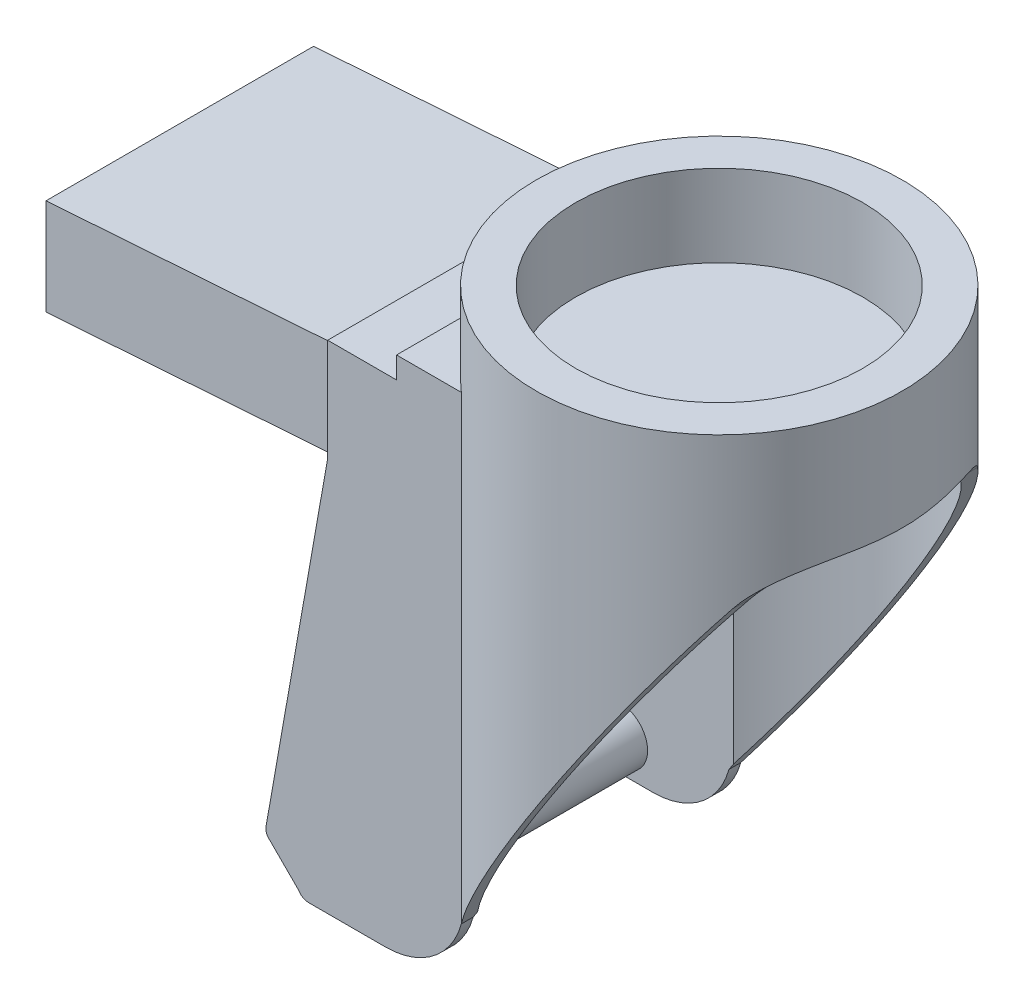
from build123d import *

# Parameters (mm, degrees)
ESTRUSIONE_ESTRUSIONE1_DEPTH         = 71
ESTRUSIONE_ESTRUSIONE5_START         = -131.7
SCHIZZO8_R                           = 46.5
ESTRUSIONE_ESTRUSIONE5_DEPTH         = 131.7
TAGLIO_ESTRUSIONE1_REACH             = 183.054
TAGLIO_ESTRUSIONE1_DIRECTION_2_REACH = 183.054
RACCORDO1_R                          = 20
TAGLIO_ESTRUSIONE2_REACH             = 188.942
SVUOTA1_START                        = -8.5
SVUOTA1_DEPTH                        = 123.2
SVUOTA1_START_2                      = 114.7
SVUOTA1_2_DEPTH                      = 5.5
ESTRUSIONE_ESTRUSIONE7_START         = 1.5
ESTRUSIONE_ESTRUSIONE7_DEPTH         = 68
ESTRUSIONE_ESTRUSIONE7_2_DEPTH       = 3
ESTRUSIONE_ESTRUSIONE7_START_2       = 66.5
ESTRUSIONE_ESTRUSIONE7_3_DEPTH       = 3
SCHIZZO15_R                          = 46.5
SCHIZZO15_R_2                        = 36.5
ESTRUSIONE_ESTRUSIONE8_DEPTH         = 20.79
ESTRUSIONE_ESTRUSIONE9_REACH         = 196.557
SCHIZZO16_R                          = 7.1


# Read off the part's stored shape, not the designer's step: Svuota1, Estrusione-Estrusione7
with BuildPart() as part:
    # Schizzo1 → Estrusione-Estrusione1 (new body)
    with BuildSketch(Plane.XY):
        with BuildLine():
            Line((11.3, 123.2), (104.3, 123.2))
            Line((104.3, 123.2), (104.3, 113.85))
            Line((104.3, 113.85), (24.875337306, -8.5))
            Line((24.875337306, -8.5), (-11.01, -8.5))
            ThreePointArc((-11.01, -8.5), (-12.511694022, -8.09709743), (-13.610030458, -6.996610042))
            Line((-13.610030458, -6.996610042), (-21.501342136, 0.894701636))
            ThreePointArc((-21.501342136, 0.894701636), (-21.856035983, 1.872259448), (-21.855688892, 2.912176215))
            Line((-21.855688892, 2.912176215), (-6.2, 91.7))
            Line((-6.2, 91.7), (-6.2, 117.7))
            Line((-6.2, 117.7), (11.3, 117.7))
            Line((11.3, 117.7), (11.3, 123.2))
        make_face()
    extrude(amount=ESTRUSIONE_ESTRUSIONE1_DEPTH)

    # Schizzo8 → Estrusione-Estrusione5 (add)
    with BuildSketch(Plane(origin=(0, 123.2, 0), x_dir=(1, 0, 0), z_dir=(0, 1, 0)).offset(ESTRUSIONE_ESTRUSIONE5_START)):
        with Locations((57.8, -35.5)):
            Circle(SCHIZZO8_R)
    extrude(amount=ESTRUSIONE_ESTRUSIONE5_DEPTH)

    # Schizzo9 → Taglio-Estrusione1 (cut, up to next)
    with BuildSketch(Plane.XY, mode=Mode.PRIVATE) as taglio_estrusione1_sk1:
        with BuildLine():
            Line((27.766685165, 6.220424861), (92.30584512, 105.64))
            add(Edge.make_bspline(
                [(92.30584512, 105.64), (97.635444472, 113.85), (104.3, 113.85)],
                knots=[0, 0, 0, 1, 1, 1], degree=2, weights=[1, 0.701406821, 1]))
            Line((104.3, 113.85), (104.3, -8.5))
            Line((104.3, -8.5), (27.766685165, -8.5))
            Line((27.766685165, -8.5), (27.766685165, 6.220424861))
        make_face()
    taglio_estrusione1_tool1 = extrude(taglio_estrusione1_sk1.sketch, amount=TAGLIO_ESTRUSIONE1_REACH, mode=Mode.PRIVATE) & part.part
    add(taglio_estrusione1_tool1.solids().sort_by_distance((76.036213, 35.53967, 0))[0], mode=Mode.SUBTRACT)

    # Schizzo9 → Taglio-Estrusione1 direction 2 (cut, up to next)
    with BuildSketch(Plane.XY, mode=Mode.PRIVATE) as taglio_estrusione1_direction_2_sk1:
        with BuildLine():
            Line((27.766685165, 6.220424861), (92.30584512, 105.64))
            add(Edge.make_bspline(
                [(92.30584512, 105.64), (97.635444472, 113.85), (104.3, 113.85)],
                knots=[0, 0, 0, 1, 1, 1], degree=2, weights=[1, 0.701406821, 1]))
            Line((104.3, 113.85), (104.3, -8.5))
            Line((104.3, -8.5), (27.766685165, -8.5))
            Line((27.766685165, -8.5), (27.766685165, 6.220424861))
        make_face()
    taglio_estrusione1_direction_2_tool1 = extrude(taglio_estrusione1_direction_2_sk1.sketch, amount=-TAGLIO_ESTRUSIONE1_DIRECTION_2_REACH, mode=Mode.PRIVATE) & part.part
    add(taglio_estrusione1_direction_2_tool1.solids().sort_by_distance((76.036213, 35.53967, 0))[0], mode=Mode.SUBTRACT)

    # Raccordo1
    # the kernel refuses this fillet: 20 mm, written as the material it takes off along each edge
    with BuildSketch(Plane(origin=(27.766685165, -8.5, -48.226424704), x_dir=(-1, 0, 0), z_dir=(0, 0, 1))) as raccordo1_piece_1:
        with BuildLine():
            CenterArc((19.290569882, -20), RACCORDO1_R, 90, 74.693720794)
            Line((0, -14.720424861), (-0.385811398, -14.614833358))
            ThreePointArc((-0.385811398, -14.614833358), (-0.4, -7.360212431), (-0.4, 0))
            Line((-0.4, 0), (0, 0.4))
            Line((0, 0.4), (19.290569882, 0.4))
            Line((19.290569882, 0.4), (19.290569882, 0))
        make_face()
    extrude(amount=167.452849408, mode=Mode.SUBTRACT)

    # Schizzo10 → Taglio-Estrusione2 (cut, up to next)
    with BuildSketch(Plane(origin=(0, 123.2, 0), x_dir=(1, 0, 0), z_dir=(0, 1, 0)), mode=Mode.PRIVATE) as taglio_estrusione2_sk1:
        with BuildLine():
            Line((104.3, 0), (87.833314835, 0))
            ThreePointArc((87.833314835, 0), (99.982929872, -15.933435984), (104.3, -35.500000151))
            Line((104.3, -35.500000151), (104.3, 0))
        make_face()
    taglio_estrusione2_tool1 = extrude(taglio_estrusione2_sk1.sketch, amount=-TAGLIO_ESTRUSIONE2_REACH, mode=Mode.PRIVATE) & part.part
    # Schizzo10 → Taglio-Estrusione2 (cut, up to next)
    with BuildSketch(Plane(origin=(0, 123.2, 0), x_dir=(1, 0, 0), z_dir=(0, 1, 0)), mode=Mode.PRIVATE) as taglio_estrusione2_sk2:
        with BuildLine():
            Line((104.3, -71), (104.3, -35.500000151))
            ThreePointArc((104.3, -35.500000151), (99.982929809, -55.066564153), (87.833314835, -71))
            Line((87.833314835, -71), (104.3, -71))
        make_face()
    taglio_estrusione2_tool2 = extrude(taglio_estrusione2_sk2.sketch, amount=-TAGLIO_ESTRUSIONE2_REACH, mode=Mode.PRIVATE) & part.part
    add(taglio_estrusione2_tool1.solids().sort_by_distance((99.557164, 123.2, 8.530088))[0], mode=Mode.SUBTRACT)
    add(taglio_estrusione2_tool2.solids().sort_by_distance((99.557164, 123.2, 62.469912))[0], mode=Mode.SUBTRACT)

    # Svuota1 outline → Svuota1 (cut)
    with BuildSketch(Plane(origin=(0, 0, 0), x_dir=(1, 0, 0), z_dir=(0, 1, 0)).offset(SVUOTA1_START)):
        with BuildLine():
            ThreePointArc((28.88633541, -68), (101.3, -35.5), (28.88633541, -3))
            Line((28.88633541, -3), (-23, -3))
            Line((-23, -3), (-23, -68))
            Line((-23, -68), (28.88633541, -68))
        make_face()
    extrude(amount=SVUOTA1_DEPTH, mode=Mode.SUBTRACT)

    # Svuota1 2 outline → Svuota1 2 (cut)
    with BuildSketch(Plane(origin=(0, 0, 0), x_dir=(1, 0, 0), z_dir=(0, 1, 0)).offset(SVUOTA1_START_2)):
        with BuildLine():
            Line((14.3, -3), (14.3, -68))
            Line((14.3, -68), (28.88633541, -68))
            ThreePointArc((28.88633541, -68), (101.3, -35.5), (28.88633541, -3))
            Line((28.88633541, -3), (14.3, -3))
        make_face()
    extrude(amount=SVUOTA1_2_DEPTH, mode=Mode.SUBTRACT)

    # Estrusione-Estrusione7 outline → Estrusione-Estrusione7 (add)
    with BuildSketch(Plane.XY.offset(ESTRUSIONE_ESTRUSIONE7_START)):
        Polygon((-6.2, 114.7), (-6.2, 116.2), (-79.280324347, 111.089725903), (-79.280324347, 108.089725903), (3.775640503, 113.897564737), (3.775640503, 114.7), align=None)
    extrude(amount=ESTRUSIONE_ESTRUSIONE7_DEPTH)

    # Estrusione-Estrusione7 2 outline → Estrusione-Estrusione7 2 (add)
    with BuildSketch(Plane.XY.offset(ESTRUSIONE_ESTRUSIONE7_START)):
        Polygon((-79.280324347, 108.089725903), (-79.280324347, 86.589725903), (3.775640503, 92.397564737), (3.775640503, 113.897564737), align=None)
    extrude(amount=ESTRUSIONE_ESTRUSIONE7_2_DEPTH)

    # Estrusione-Estrusione7 3 outline → Estrusione-Estrusione7 3 (add)
    with BuildSketch(Plane.XY.offset(ESTRUSIONE_ESTRUSIONE7_START_2)):
        Polygon((-79.280324347, 108.089725903), (-79.280324347, 86.589725903), (3.775640503, 92.397564737), (3.775640503, 113.897564737), align=None)
    extrude(amount=ESTRUSIONE_ESTRUSIONE7_3_DEPTH)

    # Schizzo15 → Estrusione-Estrusione8 (add)
    with BuildSketch(Plane(origin=(0, 123.2, 0), x_dir=(1, 0, 0), z_dir=(0, 1, 0))):
        with Locations(Location((57.8, -35.5, 0), (0, 0, 180))):
            Circle(SCHIZZO15_R)
        with Locations(Location((57.8, -35.5, 0), (0, 0, 180))):
            Circle(SCHIZZO15_R_2, mode=Mode.SUBTRACT)
    extrude(amount=ESTRUSIONE_ESTRUSIONE8_DEPTH)

    # Schizzo16 → Estrusione-Estrusione9 (add, up to next)
    with BuildSketch(Plane.XY.offset(3), mode=Mode.PRIVATE) as estrusione_estrusione9_sk1:
        Circle(SCHIZZO16_R)
    estrusione_estrusione9_tool1 = extrude(estrusione_estrusione9_sk1.sketch, amount=ESTRUSIONE_ESTRUSIONE9_REACH, mode=Mode.PRIVATE) - part.part
    add(estrusione_estrusione9_tool1.solids().sort_by_distance((0, 0, 3))[0])


solid = part.part
